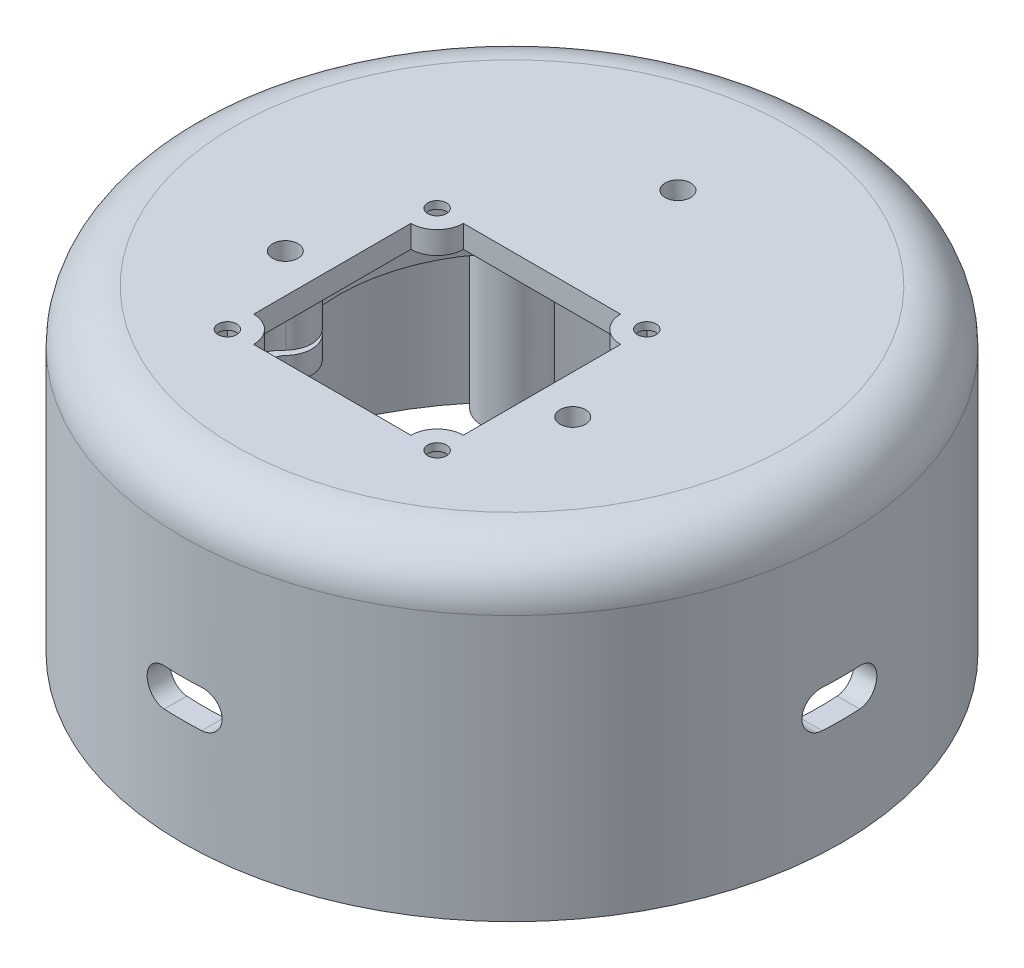
from build123d import *

# Parameters (mm, degrees)
BOSS_EXTRU_1_REACH            = 77.298
R_P_TITION_CIRCULAIRE1_COUNT  = 4
ESQUISSE5_R                   = 1.25
ENL_V_MAT_EXTRU_1_DEPTH       = 76.297808789
ENL_V_MAT_EXTRU_2_DEPTH       = 76.297808789
ENL_V_MAT_EXTRU_3_DEPTH       = 2
BOSS_EXTRU_2_START            = 5
ESQUISSE8_R                   = 32.77
ESQUISSE8_R_2                 = 26.16
BOSS_EXTRU_2_DEPTH            = 1.6
ESQUISSE9_R                   = 33.27
ESQUISSE9_R_2                 = 25.66
BOSS_EXTRU_3_DEPTH            = 5
ENL_V_START                   = -5
ENL_V_MAT_EXTRU_4_DEPTH       = 5
BOSS_EXTRU_4_DEPTH            = 6
R_P_TITION_CIRCULAIRE2_COUNT  = 3
ENL_V_MAT_EXTRU_7_DEPTH       = 76.297808733
R_P_TITION_CIRCULAIRE3_COUNT  = 4
BOSS_EXTRU_5_DEPTH            = 6
R_P_TITION_CIRCULAIRE10_COUNT = 3
CONG_1_R                      = 10
BOSS_EXTRU_6_START            = 0.6
ESQUISSE19_R                  = 34.27
ESQUISSE19_R_2                = 1.7
ESQUISSE19_R_3                = 2.175
BOSS_EXTRU_6_DEPTH            = 3


with BuildPart() as part:
    # Esquisse1 → Révolution1 (revolve)
    with BuildSketch(Plane.XY):
        with BuildLine():
            Line((0, 42.4), (37, 42.4))
            ThreePointArc((37, 42.4), (41.949747468, 40.349747468), (44, 35.4))
            Line((44, 35.4), (44, 0))
            Line((44, 0), (41, 0))
            Line((41, 0), (41, 35.4))
            ThreePointArc((41, 35.4), (39.828427125, 38.228427125), (37, 39.4))
            Line((37, 39.4), (0, 39.4))
            Line((0, 39.4), (0, 42.4))
        make_face()
    revolve(axis=Axis((0, 0, 0), (0, 1, 0)))

    # Esquisse2 → Boss.-Extru.1 (add, up to next)
    with BuildSketch(Plane.XZ, mode=Mode.PRIVATE) as boss_extru_1_sk1:
        with BuildLine():
            ThreePointArc((-26.089333127, 31.628257887), (-25.455844123, 25.455844123), (-31.628257887, 26.089333127))
            ThreePointArc((-31.628257887, 26.089333127), (-28.991378029, 28.991378029), (-26.089333127, 31.628257887))
        make_face()
    boss_extru_1_tool1 = extrude(boss_extru_1_sk1.sketch, amount=-BOSS_EXTRU_1_REACH, mode=Mode.PRIVATE) - part.part
    boss_extru_1 = boss_extru_1_tool1.solids().sort_by_distance((-27.433502, 0, 27.433502))[0]
    add(boss_extru_1)

    # Esquisse4 → Chambrage pour vis à tête hexagonale M51 (revolve, cut)
    with BuildSketch(Plane(origin=(-28.284271247, 0, 28.284271247), x_dir=(0, 0, -1), z_dir=(1, 0, 0))):
        Polygon((0, 0), (0, 16.021463052), (1.7, 15), (1.7, 4.8), (2.175, 4.8), (2.175, 0), align=None)
    chambrage_pour_vis_t_te_hexagonale_m51 = revolve(axis=Axis((-28.284271247, -6.35, 28.284271247), (0, 1, 0)), mode=Mode.SUBTRACT)

    # Répétition circulaire1: Boss.-Extru.1, Chambrage pour vis à tête hexagonale M51 ×4 about axis
    r_p_tition_circulaire1_axis = Axis((0, 0, 0), (0, 1, 0))
    add([boss_extru_1.rotate(r_p_tition_circulaire1_axis, i * 360 / R_P_TITION_CIRCULAIRE1_COUNT) for i in range(1, R_P_TITION_CIRCULAIRE1_COUNT)])
    add([chambrage_pour_vis_t_te_hexagonale_m51.rotate(r_p_tition_circulaire1_axis, i * 360 / R_P_TITION_CIRCULAIRE1_COUNT) for i in range(1, R_P_TITION_CIRCULAIRE1_COUNT)], mode=Mode.SUBTRACT)

    # Esquisse5 → Enlèv. mat.-Extru.1 (cut, through all)
    with BuildSketch(Plane(origin=(0, 42.4, 0), x_dir=(1, 0, 0), z_dir=(0, 1, 0))):
        with Locations(Location((-14, 4, 0), (0, 0, 270))):
            Circle(ESQUISSE5_R)
        with Locations(Location((14, 4, 0), (0, 0, 270))):
            Circle(ESQUISSE5_R)
        with Locations(Location((14, -24, 0), (0, 0, 270))):
            Circle(ESQUISSE5_R)
        with Locations(Location((-14, -24, 0), (0, 0, 270))):
            Circle(ESQUISSE5_R)
    extrude(amount=-ENL_V_MAT_EXTRU_1_DEPTH, mode=Mode.SUBTRACT)

    # Esquisse6 → Enlèv. mat.-Extru.2 (cut, through all)
    with BuildSketch(Plane(origin=(0, 42.4, 0), x_dir=(1, 0, 0), z_dir=(0, 1, 0))):
        with BuildLine():
            Line((-14, -10), (-14, 0.5))
            ThreePointArc((-14, 0.5), (-11.525126266, 1.525126266), (-10.5, 4))
            Line((-10.5, 4), (0, 4))
            Line((0, 4), (10.5, 4))
            ThreePointArc((10.5, 4), (11.525126266, 1.525126266), (14, 0.5))
            Line((14, 0.5), (14, -10))
            Line((14, -10), (14, -20.5))
            ThreePointArc((14, -20.5), (11.525126266, -21.525126266), (10.5, -24))
            Line((10.5, -24), (0, -24))
            Line((0, -24), (-10.5, -24))
            ThreePointArc((-10.5, -24), (-11.525126266, -21.525126266), (-14, -20.5))
            Line((-14, -20.5), (-14, -10))
        make_face()
    extrude(amount=-ENL_V_MAT_EXTRU_2_DEPTH, mode=Mode.SUBTRACT)

    # Esquisse7 → Enlèv. mat.-Extru.3 (cut)
    with BuildSketch(Plane.XZ.offset(-39.4)):
        Polygon((-12.264944766, 25.735055234), (-14.635074293, 26.370129527), (-16.370129527, 24.635074293), (-15.735055234, 22.264944766), (-13.364925707, 21.629870473), (-11.629870473, 23.364925707), align=None)
        Polygon((15.735055234, 22.264944766), (16.370129527, 24.635074293), (14.635074293, 26.370129527), (12.264944766, 25.735055234), (11.629870473, 23.364925707), (13.364925707, 21.629870473), align=None)
        Polygon((12.264944766, -5.735055234), (14.635074293, -6.370129527), (16.370129527, -4.635074293), (15.735055234, -2.264944766), (13.364925707, -1.629870473), (11.629870473, -3.364925707), align=None)
        Polygon((-15.735055234, -2.264944766), (-16.370129527, -4.635074293), (-14.635074293, -6.370129527), (-12.264944766, -5.735055234), (-11.629870473, -3.364925707), (-13.364925707, -1.629870473), align=None)
    extrude(amount=-ENL_V_MAT_EXTRU_3_DEPTH, mode=Mode.SUBTRACT)

    # Esquisse9 → Boss.-Extru.3 (add)
    with BuildSketch(Plane.XZ.offset(-39.4)):
        with Locations(Location((0, 0, 0), (0, 0, 270))):
            Circle(ESQUISSE9_R)
        with Locations(Location((0, 0, 0), (0, 0, 69.277940879))):
            Circle(ESQUISSE9_R_2, mode=Mode.SUBTRACT)
    extrude(amount=BOSS_EXTRU_3_DEPTH)

    # Esquisse10 → Enlèv. mat.-Extru.4 (cut)
    with BuildSketch(Plane.XZ.offset(-34.4).offset(ENL_V_START)):
        with BuildLine():
            Line((-25.01895477, 21.930453762), (-19.296254265, 16.914200286))
            ThreePointArc((-19.296254265, 16.914200286), (0, 25.66), (19.296254265, 16.914200286))
            Line((19.296254265, 16.914200286), (25.01895477, 21.930453762))
            ThreePointArc((25.01895477, 21.930453762), (0, 33.27), (-25.01895477, 21.930453762))
        make_face()
        with BuildLine():
            Line((6.482852689, -32.632277288), (5, -25.168146535))
            ThreePointArc((5, -25.168146535), (22.222211861, -12.83), (24.296254265, 8.253946249))
            Line((24.296254265, 8.253946249), (31.501807459, 10.701823526))
            ThreePointArc((31.501807459, 10.701823526), (28.812665184, -16.635), (6.482852689, -32.632277288))
        make_face()
        with BuildLine():
            Line((-31.501807459, 10.701823526), (-24.296254265, 8.253946249))
            ThreePointArc((-24.296254265, 8.253946249), (-22.222211861, -12.83), (-5, -25.168146535))
            Line((-5, -25.168146535), (-6.482852689, -32.632277288))
            ThreePointArc((-6.482852689, -32.632277288), (-28.812665184, -16.635), (-31.501807459, 10.701823526))
        make_face()
    extrude(amount=ENL_V_MAT_EXTRU_4_DEPTH, mode=Mode.SUBTRACT)

    # Esquisse11 → Boss.-Extru.4 (add)
    with BuildSketch(Plane.XZ.offset(-39.4)):
        with BuildLine():
            Line((-5, -25.168146535), (-4.805144193, -24.187314636))
            ThreePointArc((-4.805144193, -24.187314636), (0, -24.66), (4.805144193, -24.187314636))
            Line((4.805144193, -24.187314636), (5, -25.168146535))
            ThreePointArc((5, -25.168146535), (0, -25.66), (-5, -25.168146535))
        make_face()
        with BuildLine():
            Line((-6.482852689, -32.632277288), (-6.677708496, -33.613109187))
            ThreePointArc((-6.677708496, -33.613109187), (0, -34.27), (6.677708496, -33.613109187))
            Line((6.677708496, -33.613109187), (6.482852689, -32.632277288))
            ThreePointArc((6.482852689, -32.632277288), (0, -33.27), (-6.482852689, -32.632277288))
        make_face()
    boss_extru_4 = extrude(amount=BOSS_EXTRU_4_DEPTH)

    # Répétition circulaire2: Boss.-Extru.4 ×3 about axis
    r_p_tition_circulaire2_axis = Axis((0, 0, 0), (0, 1, 0))
    for i in range(1, R_P_TITION_CIRCULAIRE2_COUNT):
        add(boss_extru_4.rotate(r_p_tition_circulaire2_axis, i * 360 / R_P_TITION_CIRCULAIRE2_COUNT))

    # Esquisse16 → Enlèv. mat.-Extru.7 (cut, through all)
    with BuildSketch(Plane(origin=(0, 0, 0), x_dir=(0, 0, 1), z_dir=(1, 0, 0))):
        with BuildLine():
            Line((-2.5, -14.2), (2.5, -14.2))
            ThreePointArc((2.5, -14.2), (5, -16.7), (2.5, -19.2))
            Line((2.5, -19.2), (-2.5, -19.2))
            ThreePointArc((-2.5, -19.2), (-5, -16.7), (-2.5, -14.2))
        make_face()
    enl_v_mat_extru_7 = extrude(amount=-ENL_V_MAT_EXTRU_7_DEPTH, mode=Mode.SUBTRACT)

    # Répétition circulaire3: Enlèv. mat.-Extru.7 ×4 about axis
    r_p_tition_circulaire3_axis = Axis((0, 0, 0), (0, -1, 0))
    for i in range(1, R_P_TITION_CIRCULAIRE3_COUNT):
        add(enl_v_mat_extru_7.rotate(r_p_tition_circulaire3_axis, i * 360 / R_P_TITION_CIRCULAIRE3_COUNT), mode=Mode.SUBTRACT)

    # Esquisse17 → Boss.-Extru.5 (add)
    with BuildSketch(Plane.XZ.offset(-39.4)):
        with BuildLine():
            ThreePointArc((-22.529154794, 10.027601123), (-18.658728104, 7.620729018), (-15.691122948, 11.08))
            ThreePointArc((-15.691122948, 11.08), (-17.000419997, 13.809619127), (-19.948734708, 14.497019816))
            ThreePointArc((-19.948734708, 14.497019816), (-21.356186457, 12.33), (-22.529154794, 10.027601123))
        make_face()
        with BuildLine():
            ThreePointArc((-22.529154794, 10.027601123), (-21.356186457, 12.33), (-19.948734708, 14.497019816))
            ThreePointArc((-19.948734708, 14.497019816), (-22.222211861, 12.83), (-22.529154794, 10.027601123))
        make_face()
    boss_extru_5 = extrude(amount=BOSS_EXTRU_5_DEPTH)

    # Esquisse18 → Chambrage pour vis à tête hexagonale M52 (revolve, cut)
    with BuildSketch(Plane(origin=(-19.191122948, 33.4, 11.08), x_dir=(0, 0, -1), z_dir=(1, 0, 0))):
        Polygon((0, 0), (0, 11.021463052), (1.7, 10), (1.7, 4.8), (2.175, 4.8), (2.175, 0), align=None)
    chambrage_pour_vis_t_te_hexagonale_m52 = revolve(axis=Axis((-19.191122948, 27.05, 11.08), (0, 1, 0)), mode=Mode.SUBTRACT)

    # Répétition circulaire10: Boss.-Extru.5, Chambrage pour vis à tête hexagonale M52 ×3 about axis
    r_p_tition_circulaire10_axis = Axis((0, 0, 0), (0, 1, 0))
    add([boss_extru_5.rotate(r_p_tition_circulaire10_axis, i * 360 / R_P_TITION_CIRCULAIRE10_COUNT) for i in range(1, R_P_TITION_CIRCULAIRE10_COUNT)])
    add([chambrage_pour_vis_t_te_hexagonale_m52.rotate(r_p_tition_circulaire10_axis, i * 360 / R_P_TITION_CIRCULAIRE10_COUNT) for i in range(1, R_P_TITION_CIRCULAIRE10_COUNT)], mode=Mode.SUBTRACT)

    # Congé1
    # the kernel refuses this fillet: 10 mm, written as the material it adds along each edge
    with BuildSketch(Plane(origin=(-22.529154794, 33.4, 10.027601123), x_dir=(0.7290443704863045, 0, -0.6844664388136411), z_dir=(0, 1, 0)), Plane(origin=(2.580420085, 33.4, -24.524620939), x_dir=(0.22824313880732963, 0, 0.9736041647339939), z_dir=(0, 1, 0)), Plane(origin=(19.948734708, 33.4, 14.497019816), x_dir=(-0.9572875092936326, 0, -0.28913772592035314), z_dir=(0, 1, 0))) as cong_1_piece_1:
        with BuildLine():
            CenterArc((8.321459269, 8.72004642), CONG_1_R, 221.536984439, 19.155449666)
            Line((0.836180835, 2.089012808), (0.686475266, 1.956392135))
            ThreePointArc((0.686475266, 1.956392135), (0.208573315, 1.128370986), (-0.188875182, 0.065773595))
            Line((-0.188875182, 0.065773595), (0.097899521, -0.174400928))
            ThreePointArc((0.097899521, -0.174400928), (1.713241614, 0.247983753), (3.328583708, -0.174400928))
            Line((3.328583708, -0.174400928), (3.426483228, 0))
        make_face()
    extrude(amount=6)
    with BuildSketch(Plane(origin=(-19.948734708, 39.4, 14.497019816), x_dir=(0.6241709111959102, 0, 0.7812878301988759), z_dir=(0, -1, 0)), Plane(origin=(-2.580420085, 39.4, -24.524620939), x_dir=(-0.9887005642178042, 0, 0.1499039502995022), z_dir=(0, -1, 0)), Plane(origin=(22.529154794, 39.4, 10.027601123), x_dir=(0.3645296530218963, 0, -0.9311917804983761), z_dir=(0, -1, 0))) as cong_1_piece_2:
        with BuildLine():
            CenterArc((11.187938, -4.4850794), CONG_1_R, 153.352004841, 19.155449666)
            Line((1.273319649, -3.181107415), (1.075027282, -3.155027975))
            ThreePointArc((1.075027282, -3.155027975), (0.866885074, -1.49840016), (-0.125531244, -0.155698127))
            Line((-0.125531244, -0.155698127), (-0.009124694, 0.199791741))
            ThreePointArc((-0.009124694, 0.199791741), (1.125074764, 0.225678277), (2.071393759, 0.089701588))
            Line((2.071393759, 0.089701588), (2.250149528, 0))
        make_face()
    extrude(amount=6)


with BuildPart() as body_2:
    # Esquisse8 → Boss.-Extru.2 (new body)
    with BuildSketch(Plane.XZ.offset(-39.4).offset(BOSS_EXTRU_2_START)):
        with Locations(Location((0, 0, 0), (0, 0, 270))):
            Circle(ESQUISSE8_R)
        with Locations(Location((0, 0, 0), (0, 0, 270))):
            Circle(ESQUISSE8_R_2, mode=Mode.SUBTRACT)
    extrude(amount=BOSS_EXTRU_2_DEPTH)


with BuildPart() as body_3:
    # Esquisse19 → Boss.-Extru.6 (new body)
    # profile 1 of 2: a face of its own
    with BuildSketch(Plane.XZ.offset(-33.4).offset(BOSS_EXTRU_6_START)):
        with Locations(Location((0, 0, 0), (0, 0, 270))):
            Circle(ESQUISSE19_R)
        with Locations(Location((-19.191122948, 11.08, 0), (0, 0, 270))):
            Circle(ESQUISSE19_R_2, mode=Mode.SUBTRACT)
        with Locations(Location((0, -22.16, 0), (0, 0, 270))):
            Circle(ESQUISSE19_R_2, mode=Mode.SUBTRACT)
        with BuildLine():
            ThreePointArc((-16.668605113, 13.506294247), (-17.186893581, 14.794244897), (-16.666579313, 16.081378485))
            ThreePointArc((-16.666579313, 16.081378485), (0, 23.16), (16.666579313, 16.081378485))
            ThreePointArc((16.666579313, 16.081378485), (17.186893581, 14.794244897), (16.668605113, 13.506294247))
            ThreePointArc((16.668605113, 13.506294247), (17.721571004, 14.802096399), (18.544256827, 16.255034258))
            Line((18.544256827, 16.255034258), (19.296254265, 16.914200286))
            ThreePointArc((19.296254265, 16.914200286), (22.222211861, 12.83), (24.296254265, 8.253946249))
            Line((24.296254265, 8.253946249), (23.34940102, 7.932280378))
            ThreePointArc((23.34940102, 7.932280378), (21.679777013, 7.946282485), (20.031096486, 7.68228835))
            ThreePointArc((20.031096486, 7.68228835), (21.405638701, 7.487164005), (22.260171953, 6.392991837))
            ThreePointArc((22.260171953, 6.392991837), (20.057148352, -11.58), (5.59359264, -22.474370322))
            ThreePointArc((5.59359264, -22.474370322), (4.21874512, -22.281408901), (3.362491372, -21.188582597))
            ThreePointArc((3.362491372, -21.188582597), (0, -18.66), (-3.362491372, -21.188582597))
            ThreePointArc((-3.362491372, -21.188582597), (-4.21874512, -22.281408901), (-5.59359264, -22.474370322))
            ThreePointArc((-5.59359264, -22.474370322), (-20.057148352, -11.58), (-22.260171953, 6.392991837))
            ThreePointArc((-22.260171953, 6.392991837), (-21.405638701, 7.487164005), (-20.031096486, 7.68228835))
            ThreePointArc((-20.031096486, 7.68228835), (-16.160034035, 9.33), (-16.668605113, 13.506294247))
        make_face(mode=Mode.SUBTRACT)
    # profile 2 of 2: a face of its own
    with BuildSketch(Plane.XZ.offset(-33.4).offset(BOSS_EXTRU_6_START)):
        with BuildLine():
            ThreePointArc((20.031096486, 7.68228835), (21.679777013, 7.946282485), (23.34940102, 7.932280378))
            Line((23.34940102, 7.932280378), (24.296254265, 8.253946249))
            ThreePointArc((24.296254265, 8.253946249), (22.222211861, 12.83), (19.296254265, 16.914200286))
            Line((19.296254265, 16.914200286), (18.544256827, 16.255034258))
            ThreePointArc((18.544256827, 16.255034258), (17.721571004, 14.802096399), (16.668605113, 13.506294247))
            ThreePointArc((16.668605113, 13.506294247), (16.160034035, 9.33), (20.031096486, 7.68228835))
        make_face()
        with Locations(Location((19.191122948, 11.08, 0), (0, 0, 270))):
            Circle(ESQUISSE19_R_3, mode=Mode.SUBTRACT)
    extrude(amount=BOSS_EXTRU_6_DEPTH)


solid = Compound([part.part, body_2.part, body_3.part])
